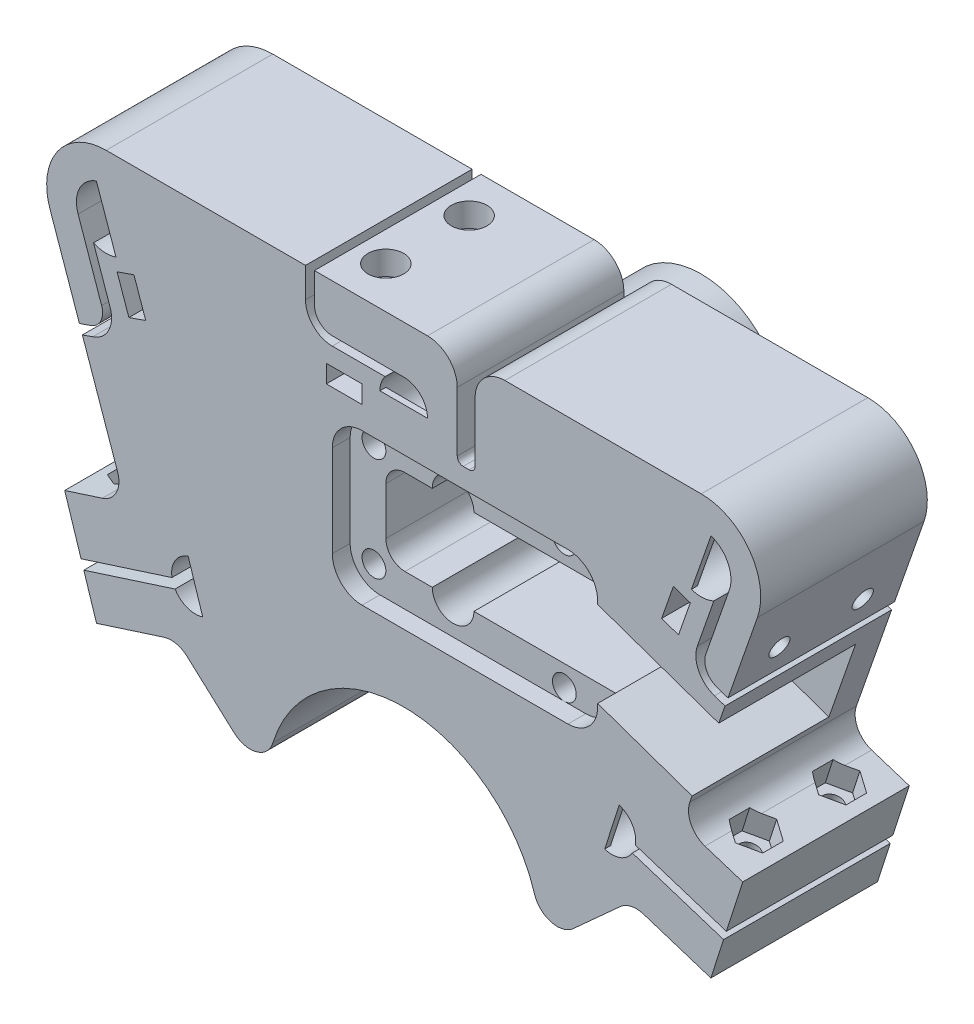
from build123d import *
from build123d.topology import SkipClean

# Parameters (mm, degrees)
SZKIC1_R                    = 4
DODANIE_WYCI_GNI_CIE1_DEPTH = 28
ZAOKR_GLENIE1_R             = 4
SZKIC2_R                    = 1.7
WYTNIJ_WYCI_GNI_CIE1_DEPTH  = 92.934955481
SZKIC3_R                    = 3
WYTNIJ_WYCI_GNI_CIE2_DEPTH  = 3
WYTNIJ_WYCI_GNI_CIE3_DEPTH  = 4
SZKIC5_R                    = 1.7
WYTNIJ_WYCI_GNI_CIE4_DEPTH  = 10
WYTNIJ_WYCI_GNI_CIE5_START  = -9.5
SZKIC6_R                    = 1.7
WYTNIJ_WYCI_GNI_CIE5_DEPTH  = 3
SZKIC7_R                    = 1.7
WYTNIJ_WYCI_GNI_CIE6_DEPTH  = 14
WYTNIJ_WYCI_GNI_CIE7_START  = -12.5
SZKIC8_R                    = 1.7
WYTNIJ_WYCI_GNI_CIE7_DEPTH  = 3
DODANIE_WYCI_GNI_CIE2_START = -1
DODANIE_WYCI_GNI_CIE2_DEPTH = 1
SZKIC14_R                   = 3
WYTNIJ_WYCI_GNI_CIE9_DEPTH  = 4
WYTNIJ_WYCI_GNI_CIE10_START = -23
SZKIC15_R                   = 4
SZKIC15_W                   = 10
SZKIC15_H                   = 14.4
WYTNIJ_WYCI_GNI_CIE10_DEPTH = 23
WYTNIJ_WYCI_GNI_CIE11_DEPTH = 3
SZKIC17_R                   = 2
WYTNIJ_WYCI_GNI_CIE12_DEPTH = 6
SZKIC18_R                   = 2
WYTNIJ_WYCI_GNI_CIE13_DEPTH = 4
WYTNIJ_WYCI_GNI_CIE14_START = -4
SZKIC19_R                   = 4
SZKIC19_W                   = 13
SZKIC19_H                   = 8
WYTNIJ_WYCI_GNI_CIE14_DEPTH = 4
DODANIE_WYCI_GNI_CIE3_START = 22
SZKIC20_R                   = 14
SZKIC20_R_2                 = 4
DODANIE_WYCI_GNI_CIE3_DEPTH = 22
SZKIC21_R                   = 11.05
SZKIC21_R_2                 = 4
WYTNIJ_WYCI_GNI_CIE15_DEPTH = 7
SZKIC22_R                   = 8
SZKIC22_R_2                 = 4
WYTNIJ_WYCI_GNI_CIE16_DEPTH = 15
SFAZOWANIE1_SIZE            = 2
SFAZOWANIE2_SIZE            = 5
SFAZOWANIE3_SIZE            = 0.5
SFAZOWANIE3_SIZE2           = 12


# Some blends are built 0.0001 mm under size
with BuildPart() as part:
    # Szkic1 → Dodanie-wyciągnięcie1 (new body)
    with BuildSketch(Plane.XY):
        with BuildLine():
            Line((-16.5, 10), (-50, 10))
            ThreePointArc((-50, 10), (-58.153539415, 5.789628228), (-59.44119239, -3.296040997))
            Line((-59.44119239, -3.296040997), (-54.497130895, -17.457829582))
            Line((-54.497130895, -17.457829582), (-52.608892417, -16.798621383))
            ThreePointArc((-52.608892417, -16.798621383), (-50.895729486, -15.269847132), (-50.765346999, -12.977451367))
            Line((-50.765346999, -12.977451367), (-54.720596195, -1.648020498))
            ThreePointArc((-54.720596195, -1.648020498), (-46.287105711, 3.348793215), (-52.124779238, -4.526070392))
            Line((-52.124779238, -4.526070392), (-49.347144245, -12.482338649))
            ThreePointArc((-49.347144245, -12.482338649), (-49.573478973, -15.984903044), (-52.245639943, -18.260587666))
            Line((-52.245639943, -18.260587666), (-54.002724745, -18.874008441))
            Line((-54.002724745, -18.874008441), (-46.73072499, -39.703952248))
            Line((-46.73072499, -39.703952248), (-56.971706107, -42.992648268))
            Line((-56.971706107, -42.992648268), (-54.219935067, -51.561647984))
            Line((-54.219935067, -51.561647984), (-38.945736554, -46.656630069))
            ThreePointArc((-38.945736554, -46.656630069), (-31.247605059, -44.614528164), (-38.425704632, -48.065078151))
            Line((-38.425704632, -48.065078151), (-53.76130656, -52.989814604))
            Line((-53.76130656, -52.989814604), (-51.621040196, -59.654592161))
            Line((-51.621040196, -59.654592161), (-38.116801548, -55.317963143))
            Line((-38.116801548, -55.317963143), (-23, -69))
            ThreePointArc((-23, -69), (0, -46), (23, -69))
            Line((23, -69), (38.116801548, -55.317963143))
            Line((38.116801548, -55.317963143), (51.621040196, -59.654592161))
            Line((51.621040196, -59.654592161), (53.76130656, -52.989814604))
            Line((53.76130656, -52.989814604), (38.425704632, -48.065078151))
            ThreePointArc((38.425704632, -48.065078151), (31.247605059, -44.614528164), (38.945736554, -46.656630069))
            Line((38.945736554, -46.656630069), (54.219935067, -51.561647984))
            Line((54.219935067, -51.561647984), (56.971706107, -42.992648268))
            Line((56.971706107, -42.992648268), (46.73072499, -39.703952248))
            Line((46.73072499, -39.703952248), (54.002724745, -18.874008441))
            Line((54.002724745, -18.874008441), (52.245639943, -18.260587666))
            ThreePointArc((52.245639943, -18.260587666), (49.573478973, -15.984903044), (49.347144245, -12.482338649))
            Line((49.347144245, -12.482338649), (52.124779238, -4.526070392))
            ThreePointArc((52.124779238, -4.526070392), (46.287105711, 3.348793215), (54.720596195, -1.648020498))
            Line((54.720596195, -1.648020498), (50.765346999, -12.977451367))
            ThreePointArc((50.765346999, -12.977451367), (50.895729486, -15.269847132), (52.608892417, -16.798621383))
            Line((52.608892417, -16.798621383), (54.497130895, -17.457829582))
            Line((54.497130895, -17.457829582), (59.44119239, -3.296040997))
            ThreePointArc((59.44119239, -3.296040997), (58.153539415, 5.789628228), (50, 10))
            Line((50, 10), (17, 10))
            ThreePointArc((17, 10), (13.464466094, 8.535533906), (12, 5))
            Line((12, 5), (12, -5))
            ThreePointArc((12, -5), (11.707106781, -5.707106781), (11, -6))
            Line((11, -6), (10, -6))
            ThreePointArc((10, -6), (9.292893219, -5.707106781), (9, -5))
            Line((9, -5), (9, 5))
            ThreePointArc((9, 5), (7.535533906, 8.535533906), (4, 10))
            Line((4, 10), (-15, 10))
            Line((-15, 10), (-15, 5))
            ThreePointArc((-15, 5), (-14.121320344, 2.878679656), (-12, 2))
            Line((-12, 2), (0, 2))
            ThreePointArc((0, 2), (1.732050808, -5.605551275), (-3.122498999, 0.5))
            Line((-3.122498999, 0.5), (-12, 0.5))
            ThreePointArc((-12, 0.5), (-15.181980515, 1.818019485), (-16.5, 5))
            Line((-16.5, 5), (-16.5, 10))
        make_face()
        with Locations((0, -22)):
            Circle(SZKIC1_R, mode=Mode.SUBTRACT)
    extrude(amount=DODANIE_WYCI_GNI_CIE1_DEPTH)

    # Zaokrąglenie1
    zaokr_glenie1_edges = [part.edges().sort_by_distance(p)[0] for p in [
        (38.116801548, -55.317963143, 14),
        (23, -69, 14),
        (-23, -69, 14),
        (-38.116801548, -55.317963143, 14),
        (-46.73072499, -39.703952248, 14),
        (46.73072499, -39.703952248, 14),
    ]]
    fillet(zaokr_glenie1_edges, radius=ZAOKR_GLENIE1_R)

    # Szkic2 → Wytnij-wyciągnięcie1 (cut, through all)
    with BuildSketch(Plane(origin=(12.540292842, -39.050402177, 0), x_dir=(0.9521110796259562, 0.3057523377727409, 0), z_dir=(0.3057523377727409, -0.9521110796259562, 0))):
        with Locations((-62.388495324, 21)):
            Circle(SZKIC2_R)
        with Locations((-62.388495324, 7)):
            Circle(SZKIC2_R)
    wytnij_wyci_gni_cie1 = extrude(amount=-WYTNIJ_WYCI_GNI_CIE1_DEPTH, mode=Mode.SUBTRACT)

    # Szkic3 → Wytnij-wyciągnięcie2 (cut)
    with BuildSketch(Plane(origin=(12.540292842, -39.050402177, 0), x_dir=(0.9521110796259562, 0.3057523377727409, 0), z_dir=(0.3057523377727409, -0.9521110796259562, 0))):
        with Locations((-62.388495324, 21)):
            Circle(SZKIC3_R)
        with Locations((-62.388495324, 7)):
            Circle(SZKIC3_R)
    wytnij_wyci_gni_cie2 = extrude(amount=-WYTNIJ_WYCI_GNI_CIE2_DEPTH, mode=Mode.SUBTRACT)

    # Szkic4 → Wytnij-wyciągnięcie3 (cut, symmetric)
    with BuildSketch(Plane(origin=(7.189626931, -22.388458283, 0), x_dir=(0.9521110796259562, 0.30575233777274063, 0), z_dir=(-0.30575233777274063, 0.9521110796259562, 0))):
        Polygon((-62.388495324, -24.464101615), (-59.388495324, -22.732050808), (-59.388495324, -19.267949192), (-62.388495324, -17.535898385), (-65.388495324, -19.267949192), (-65.388495324, -22.732050808), align=None)
        Polygon((-62.388495324, -10.464101615), (-59.388495324, -8.732050808), (-59.388495324, -5.267949192), (-62.388495324, -3.535898385), (-65.388495324, -5.267949192), (-65.388495324, -8.732050808), align=None)
    wytnij_wyci_gni_cie3 = extrude(amount=WYTNIJ_WYCI_GNI_CIE3_DEPTH, both=True, mode=Mode.SUBTRACT)

    # Szkic5 → Wytnij-wyciągnięcie4 (cut)
    with BuildSketch(Plane(origin=(-54.009249264, -18.855319585, 0), x_dir=(0, 0, 1), z_dir=(-0.944119239013413, -0.3296040996782867, 0))):
        with Locations(Location((21, 6.480204984, 0), (0, 0, 270))):
            Circle(SZKIC5_R)
        with Locations(Location((7, 6.480204984, 0), (0, 0, 270))):
            Circle(SZKIC5_R)
    wytnij_wyci_gni_cie4 = extrude(amount=-WYTNIJ_WYCI_GNI_CIE4_DEPTH, mode=Mode.SUBTRACT)

    # Szkic6 → Wytnij-wyciągnięcie5 (cut)
    # profile 1 of 6: a face of its own
    with BuildSketch(Plane(origin=(-54.009249264, -18.855319585, 0), x_dir=(0, 0, 1), z_dir=(-0.944119239013413, -0.3296040996782867, 0)).offset(WYTNIJ_WYCI_GNI_CIE5_START)):
        Polygon((19.267949192, 3.480204984), (22.732050808, 3.480204984), (24.464101615, 6.480204984), (22.732050808, 9.480204984), (19.267949192, 9.480204984), (17.535898385, 6.480204984), align=None)
        with Locations(Location((21, 6.480204984, 0), (0, 0, 270))):
            Circle(SZKIC6_R, mode=Mode.SUBTRACT)
    # profile 2 of 6: a face of its own
    with BuildSketch(Plane(origin=(-54.009249264, -18.855319585, 0), x_dir=(0, 0, 1), z_dir=(-0.944119239013413, -0.3296040996782867, 0)).offset(WYTNIJ_WYCI_GNI_CIE5_START)):
        Polygon((28, 9.480204984), (22.732050808, 9.480204984), (24.464101615, 6.480204984), (22.732050808, 3.480204984), (28, 3.480204984), align=None)
    # profile 3 of 6: a face of its own
    with BuildSketch(Plane(origin=(-54.009249264, -18.855319585, 0), x_dir=(0, 0, 1), z_dir=(-0.944119239013413, -0.3296040996782867, 0)).offset(WYTNIJ_WYCI_GNI_CIE5_START)):
        Polygon((3.535898385, 6.480204984), (5.267949192, 9.480204984), (0, 9.480204984), (0, 3.480204984), (5.267949192, 3.480204984), align=None)
    # profile 4 of 6: a face of its own
    with BuildSketch(Plane(origin=(-54.009249264, -18.855319585, 0), x_dir=(0, 0, 1), z_dir=(-0.944119239013413, -0.3296040996782867, 0)).offset(WYTNIJ_WYCI_GNI_CIE5_START)):
        Polygon((5.267949192, 3.480204984), (8.732050808, 3.480204984), (10.464101615, 6.480204984), (8.732050808, 9.480204984), (5.267949192, 9.480204984), (3.535898385, 6.480204984), align=None)
        with Locations(Location((7, 6.480204984, 0), (0, 0, 270))):
            Circle(SZKIC6_R, mode=Mode.SUBTRACT)
    # profile 5 of 6: a face of its own
    with BuildSketch(Plane(origin=(-54.009249264, -18.855319585, 0), x_dir=(0, 0, 1), z_dir=(-0.944119239013413, -0.3296040996782867, 0)).offset(WYTNIJ_WYCI_GNI_CIE5_START)):
        with Locations(Location((21, 6.480204984, 0), (0, 0, 270))):
            Circle(SZKIC6_R)
    # profile 6 of 6: a face of its own
    with BuildSketch(Plane(origin=(-54.009249264, -18.855319585, 0), x_dir=(0, 0, 1), z_dir=(-0.944119239013413, -0.3296040996782867, 0)).offset(WYTNIJ_WYCI_GNI_CIE5_START)):
        with Locations(Location((7, 6.480204984, 0), (0, 0, 270))):
            Circle(SZKIC6_R)
    wytnij_wyci_gni_cie5 = extrude(amount=-WYTNIJ_WYCI_GNI_CIE5_DEPTH, mode=Mode.SUBTRACT)

    # Lustro1: Wytnij-wyciągnięcie1, Wytnij-wyciągnięcie2, Wytnij-wyciągnięcie3, Wytnij-wyciągnięcie4, Wytnij-wyciągnięcie5 across plane
    add(wytnij_wyci_gni_cie1.mirror(Plane(origin=(0, 0, 0), x_dir=(0, 0, 1), z_dir=(1, 0, 0))), mode=Mode.SUBTRACT)
    add(wytnij_wyci_gni_cie2.mirror(Plane(origin=(0, 0, 0), x_dir=(0, 0, 1), z_dir=(1, 0, 0))), mode=Mode.SUBTRACT)
    add(wytnij_wyci_gni_cie3.mirror(Plane(origin=(0, 0, 0), x_dir=(0, 0, 1), z_dir=(1, 0, 0))), mode=Mode.SUBTRACT)
    add(wytnij_wyci_gni_cie4.mirror(Plane(origin=(0, 0, 0), x_dir=(0, 0, 1), z_dir=(1, 0, 0))), mode=Mode.SUBTRACT)
    add(wytnij_wyci_gni_cie5.mirror(Plane(origin=(0, 0, 0), x_dir=(0, 0, 1), z_dir=(1, 0, 0))), mode=Mode.SUBTRACT)

    # Szkic7 → Wytnij-wyciągnięcie6 (cut)
    with BuildSketch(Plane(origin=(0, 10, 0), x_dir=(1, 0, 0), z_dir=(0, 1, 0))):
        with Locations(Location((-10, -21, 0), (0, 0, 270))):
            Circle(SZKIC7_R)
        with Locations(Location((-10, -7, 0), (0, 0, 270))):
            Circle(SZKIC7_R)
    extrude(amount=-WYTNIJ_WYCI_GNI_CIE6_DEPTH, mode=Mode.SUBTRACT)

    # Szkic8 → Wytnij-wyciągnięcie7 (cut)
    # profile 1 of 6: a face of its own
    with BuildSketch(Plane(origin=(0, 10, 0), x_dir=(1, 0, 0), z_dir=(0, 1, 0)).offset(WYTNIJ_WYCI_GNI_CIE7_START)):
        Polygon((-13, -19.267949192), (-13, -22.732050808), (-10, -24.464101615), (-7, -22.732050808), (-7, -19.267949192), (-10, -17.535898385), align=None)
        with Locations(Location((-10, -21, 0), (0, 0, 270))):
            Circle(SZKIC8_R, mode=Mode.SUBTRACT)
    # profile 2 of 6: a face of its own
    with BuildSketch(Plane(origin=(0, 10, 0), x_dir=(1, 0, 0), z_dir=(0, 1, 0)).offset(WYTNIJ_WYCI_GNI_CIE7_START)):
        with Locations(Location((-10, -21, 0), (0, 0, 270))):
            Circle(SZKIC8_R)
    # profile 3 of 6: a face of its own
    with BuildSketch(Plane(origin=(0, 10, 0), x_dir=(1, 0, 0), z_dir=(0, 1, 0)).offset(WYTNIJ_WYCI_GNI_CIE7_START)):
        Polygon((-7, -28), (-7, -22.732050808), (-10, -24.464101615), (-13, -22.732050808), (-13, -28), align=None)
    # profile 4 of 6: a face of its own
    with BuildSketch(Plane(origin=(0, 10, 0), x_dir=(1, 0, 0), z_dir=(0, 1, 0)).offset(WYTNIJ_WYCI_GNI_CIE7_START)):
        Polygon((-13, -5.267949192), (-13, -8.732050808), (-10, -10.464101615), (-7, -8.732050808), (-7, -5.267949192), (-10, -3.535898385), align=None)
        with Locations(Location((-10, -7, 0), (0, 0, 270))):
            Circle(SZKIC8_R, mode=Mode.SUBTRACT)
    # profile 5 of 6: a face of its own
    with BuildSketch(Plane(origin=(0, 10, 0), x_dir=(1, 0, 0), z_dir=(0, 1, 0)).offset(WYTNIJ_WYCI_GNI_CIE7_START)):
        with Locations(Location((-10, -7, 0), (0, 0, 270))):
            Circle(SZKIC8_R)
    # profile 6 of 6: a face of its own
    with BuildSketch(Plane(origin=(0, 10, 0), x_dir=(1, 0, 0), z_dir=(0, 1, 0)).offset(WYTNIJ_WYCI_GNI_CIE7_START)):
        Polygon((-10, -3.535898385), (-7, -5.267949192), (-7, 0), (-13, 0), (-13, -5.267949192), align=None)
    extrude(amount=-WYTNIJ_WYCI_GNI_CIE7_DEPTH, mode=Mode.SUBTRACT)

    # Szkic9 → Dodanie-wyciągnięcie2 (add)
    with BuildSketch(Plane.XY.offset(28).offset(DODANIE_WYCI_GNI_CIE2_START)):
        with BuildLine():
            Line((-51.648020498, 4.720596195), (-48.351979502, -4.720596195))
            ThreePointArc((-48.351979502, -4.720596195), (-45.279403805, 1.648020498), (-51.648020498, 4.720596195))
        make_face()
        with BuildLine():
            Line((4, -2), (-4, -2))
            ThreePointArc((-4, -2), (0, -6), (4, -2))
        make_face()
        with BuildLine():
            ThreePointArc((51.648020498, 4.720596195), (45.279403805, 1.648020498), (48.351979502, -4.720596195))
            Line((48.351979502, -4.720596195), (51.648020498, 4.720596195))
        make_face()
        with BuildLine():
            ThreePointArc((36.223009351, -42.191555681), (31.191555681, -44.776990649), (33.776990649, -49.808444319))
            Line((33.776990649, -49.808444319), (36.223009351, -42.191555681))
        make_face()
        with BuildLine():
            ThreePointArc((-33.776990649, -49.808444319), (-31.191555681, -44.776990649), (-36.223009351, -42.191555681))
            Line((-36.223009351, -42.191555681), (-33.776990649, -49.808444319))
        make_face()
    extrude(amount=DODANIE_WYCI_GNI_CIE2_DEPTH)

    # Szkic14 → Wytnij-wyciągnięcie9 (cut)
    with BuildSketch(Plane(origin=(0, 10, 0), x_dir=(1, 0, 0), z_dir=(0, 1, 0))):
        with Locations(Location((-10, -7, 0), (0, 0, 270))):
            Circle(SZKIC14_R)
        with Locations(Location((-10, -21, 0), (0, 0, 270))):
            Circle(SZKIC14_R)
    extrude(amount=-WYTNIJ_WYCI_GNI_CIE9_DEPTH, mode=Mode.SUBTRACT)

    # Szkic15 → Wytnij-wyciągnięcie10 (cut)
    # profile 1 of 3: a face of its own
    with BuildSketch(Plane.XY.offset(28).offset(WYTNIJ_WYCI_GNI_CIE10_START)):
        with BuildLine():
            Line((22.6, -14.8), (8.8, -14.8))
            ThreePointArc((8.8, -14.8), (5.3, -11.3), (1.8, -14.8))
            Line((1.8, -14.8), (-2.8, -14.8))
            ThreePointArc((-2.8, -14.8), (-5.0627417, -15.7372583), (-6, -18))
            Line((-6, -18), (-6, -26))
            ThreePointArc((-6, -26), (-5.0627417, -28.2627417), (-2.8, -29.2))
            Line((-2.8, -29.2), (1.8, -29.2))
            ThreePointArc((1.8, -29.2), (5.3, -32.7), (8.8, -29.2))
            Line((8.8, -29.2), (22.6, -29.2))
            Line((22.6, -29.2), (22.6, -14.8))
        make_face()
        with Locations((0, -22)):
            Circle(SZKIC15_R, mode=Mode.SUBTRACT)
    # profile 2 of 3: a face of its own
    with BuildSketch(Plane.XY.offset(28).offset(WYTNIJ_WYCI_GNI_CIE10_START)):
        with Locations((27.6, -22)):
            Rectangle(SZKIC15_W, SZKIC15_H)
    # profile 3 of 3: a face of its own
    with BuildSketch(Plane.XY.offset(28).offset(WYTNIJ_WYCI_GNI_CIE10_START)):
        Polygon((52.94532972, -21.90281478), (48.464257487, -34.73841516), (32.6, -29.2), (32.6, -14.8), align=None)
    extrude(amount=WYTNIJ_WYCI_GNI_CIE10_DEPTH, mode=Mode.SUBTRACT)

    # Szkic16 → Wytnij-wyciągnięcie11 (cut)
    with BuildSketch(Plane.XY.offset(28)):
        with BuildLine():
            Line((-7, -9.3), (27.6, -9.3))
            ThreePointArc((27.6, -9.3), (31.135533906, -10.764466094), (32.6, -14.3))
            Line((32.6, -14.3), (32.6, -29.7))
            ThreePointArc((32.6, -29.7), (31.135533906, -33.235533906), (27.6, -34.7))
            Line((27.6, -34.7), (-7, -34.7))
            ThreePointArc((-7, -34.7), (-10.535533906, -33.235533906), (-12, -29.7))
            Line((-12, -29.7), (-12, -14.3))
            ThreePointArc((-12, -14.3), (-10.535533906, -10.764466094), (-7, -9.3))
        make_face()
    extrude(amount=-WYTNIJ_WYCI_GNI_CIE11_DEPTH, mode=Mode.SUBTRACT)

    # Szkic17 → Wytnij-wyciągnięcie12 (cut)
    with BuildSketch(Plane.XY.offset(25)):
        with Locations((-8, -13.3)):
            Circle(SZKIC17_R)
        with Locations((-8, -30.7)):
            Circle(SZKIC17_R)
        with Locations((24, -32.7)):
            Circle(SZKIC17_R)
        with Locations((24, -11.3)):
            Circle(SZKIC17_R)
    extrude(amount=-WYTNIJ_WYCI_GNI_CIE12_DEPTH, mode=Mode.SUBTRACT)

    # Szkic18 → Wytnij-wyciągnięcie13 (cut)
    with BuildSketch(Plane.XY.offset(5)):
        with Locations((5.3, -14.8)):
            Circle(SZKIC18_R)
        with Locations((5.3, -29.2)):
            Circle(SZKIC18_R)
    extrude(amount=-WYTNIJ_WYCI_GNI_CIE13_DEPTH, mode=Mode.SUBTRACT)

    # Szkic19 → Wytnij-wyciągnięcie14 (cut)
    with BuildSketch(Plane.XY.offset(5).offset(WYTNIJ_WYCI_GNI_CIE14_START)):
        with Locations((0, -22)):
            Circle(SZKIC19_R)
        with Locations((15.3, -22)):
            Rectangle(SZKIC19_W, SZKIC19_H)
    extrude(amount=WYTNIJ_WYCI_GNI_CIE14_DEPTH, mode=Mode.SUBTRACT)

    # Szkic20 → Dodanie-wyciągnięcie3 (add)
    with SkipClean():  # the faces are left unmerged after this step: merging them gives an invalid solid
        with BuildSketch(Plane(origin=(0, 0, 0), x_dir=(-1, 0, 0), z_dir=(0, 0, -1)).offset(DODANIE_WYCI_GNI_CIE3_START)):
            with Locations(Location((0, -22, 0), (0, 0, 180))):
                Circle(SZKIC20_R)
            with Locations((0, -22)):
                Circle(SZKIC20_R_2, mode=Mode.SUBTRACT)
        extrude(amount=-DODANIE_WYCI_GNI_CIE3_DEPTH)

    # Szkic21 → Wytnij-wyciągnięcie15 (cut)
    with SkipClean():  # the faces are left unmerged after this step: merging them gives an invalid solid
        with BuildSketch(Plane(origin=(0, 0, -22), x_dir=(-1, 0, 0), z_dir=(0, 0, -1))):
            with Locations((0, -22)):
                Circle(SZKIC21_R)
            with Locations((0, -22)):
                Circle(SZKIC21_R_2, mode=Mode.SUBTRACT)
        extrude(amount=-WYTNIJ_WYCI_GNI_CIE15_DEPTH, mode=Mode.SUBTRACT)

    # Szkic22 → Wytnij-wyciągnięcie16 (cut)
    with BuildSketch(Plane(origin=(0, 0, -15), x_dir=(-1, 0, 0), z_dir=(0, 0, -1))):
        with Locations((0, -22)):
            Circle(SZKIC22_R)
        with Locations((0, -22)):
            Circle(SZKIC22_R_2, mode=Mode.SUBTRACT)
    extrude(amount=-WYTNIJ_WYCI_GNI_CIE16_DEPTH, mode=Mode.SUBTRACT)

    # Sfazowanie1
    sfazowanie1_edges = [part.edges().sort_by_distance(p)[0] for p in [
        (-14, -22, 0),
    ]]
    chamfer(sfazowanie1_edges, length=SFAZOWANIE1_SIZE - 0.0001)  # a hair under: the kernel refuses the full size

    # Sfazowanie2
    # the kernel refuses this chamfer: 5 mm, written as the material it takes off along each edge
    with BuildSketch(Plane(origin=(0, -69, 0), x_dir=(-0.9660498367827013, -0.2583557873400868, 0), z_dir=(0.2583557873400868, -0.9660498367827013, 0))) as sfazowanie2_piece_1:
        Polygon((23 + SFAZOWANIE2_SIZE, 0), (23, -SFAZOWANIE2_SIZE), (23, 0), align=None)
    revolve(axis=Axis((0, -69, 0), (0, 0, -1)), revolution_arc=209.945045448, mode=Mode.SUBTRACT)

    # Sfazowanie3
    sfazowanie3_edges = [part.edges().sort_by_distance(p)[0] for p in [
        (8, -22, -15),
    ]]
    sfazowanie3_side = [part.faces().sort_by_distance(p)[0] for p in [
        (10.737458803, -22, -15),
    ]]
    chamfer(sfazowanie3_edges, length=SFAZOWANIE3_SIZE, length2=SFAZOWANIE3_SIZE2, reference=sfazowanie3_side[0])


solid = part.part
